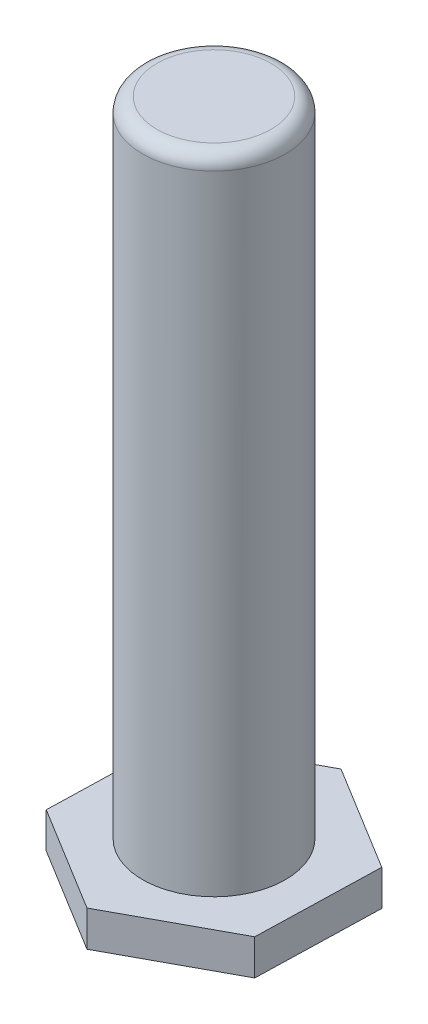
from build123d import *

# Parameters (mm, degrees)
BOSS_EXTRU_1_DEPTH = 5
ESQUISSE2_R        = 10
BOSS_EXTRU_2_DEPTH = 90
CONG_1_R           = 2


with BuildPart() as part:
    # Esquisse1 → Boss.-Extru.1 (new body)
    with BuildSketch(Plane(origin=(0, 0, 0), x_dir=(1, 0, 0), z_dir=(0, 1, 0))):
        Polygon((-14.767960782, 9.062157753), (-15.232039218, -8.258350323), (-0.464078436, -17.320508076), (14.767960782, -9.062157753), (15.232039218, 8.258350323), (0.464078436, 17.320508076), align=None)
    extrude(amount=BOSS_EXTRU_1_DEPTH)

    # Esquisse2 → Boss.-Extru.2 (add)
    with BuildSketch(Plane(origin=(0, 5, 0), x_dir=(1, 0, 0), z_dir=(0, 1, 0))):
        Circle(ESQUISSE2_R)
    extrude(amount=BOSS_EXTRU_2_DEPTH)

    # Congé1
    cong_1_edges = [part.edges().sort_by_distance(p)[0] for p in [
        (-10, 95, 0),
    ]]
    fillet(cong_1_edges, radius=CONG_1_R)


solid = part.part
